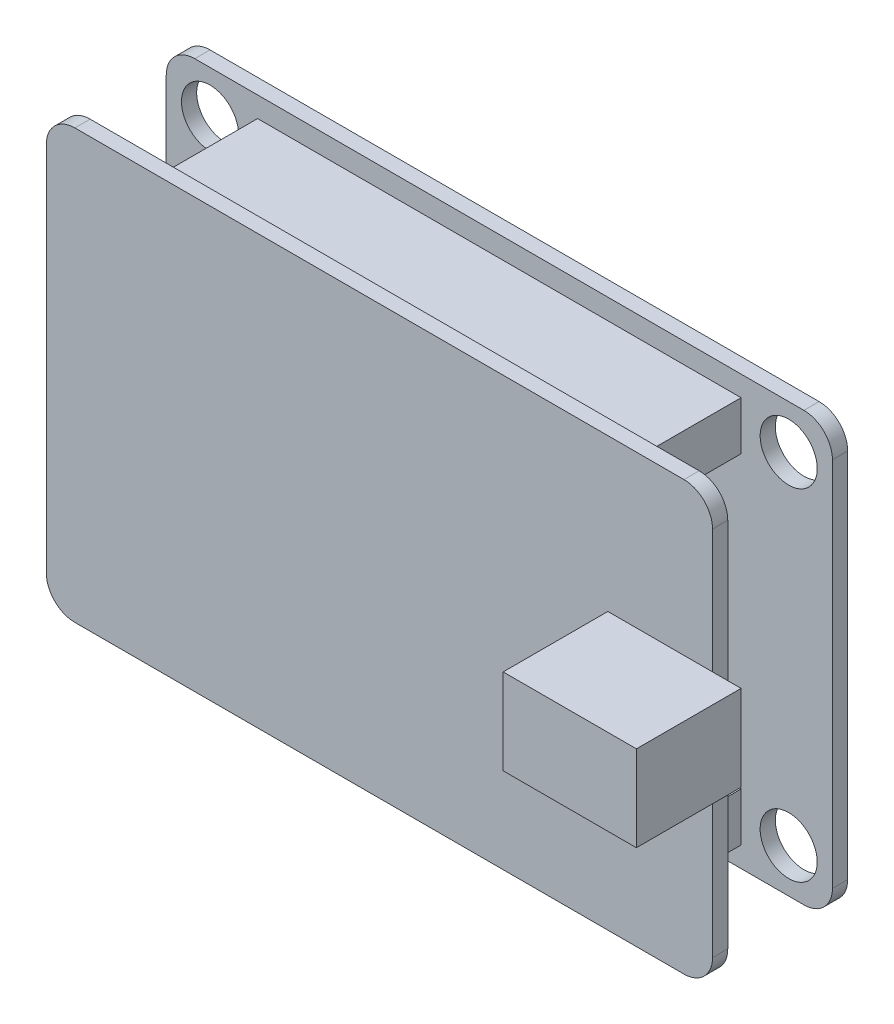
from build123d import *

# Parameters (mm, degrees)
SKETCH_1_R      = 3
EXTRUDE_1_DEPTH = 1.6
SKETCH_2_W      = 50.8
SKETCH_2_H      = 5.1
EXTRUDE_2_DEPTH = 11
EXTRUDE_3_DEPTH = 1.6
SKETCH_4_W      = 14
SKETCH_4_H      = 9
EXTRUDE_4_DEPTH = 11


with BuildPart() as part:
    # 草图1 → 凸台-拉伸1 (new body)
    with BuildSketch(Plane.XY):
        with BuildLine():
            Line((-32, -22.5), (32, -22.5))
            ThreePointArc((32, -22.5), (34.121320344, -21.621320344), (35, -19.5))
            Line((35, -19.5), (35, 19.5))
            ThreePointArc((35, 19.5), (34.121320344, 21.621320344), (32, 22.5))
            Line((32, 22.5), (-32, 22.5))
            ThreePointArc((-32, 22.5), (-34.121320344, 21.621320344), (-35, 19.5))
            Line((-35, 19.5), (-35, -19.5))
            ThreePointArc((-35, -19.5), (-34.121320344, -21.621320344), (-32, -22.5))
        make_face()
        with Locations((-30.4, 17.9)):
            Circle(SKETCH_1_R, mode=Mode.SUBTRACT)
        with Locations((30.4, 17.9)):
            Circle(SKETCH_1_R, mode=Mode.SUBTRACT)
        with Locations((30.4, -17.9)):
            Circle(SKETCH_1_R, mode=Mode.SUBTRACT)
        with Locations((-30.4, -17.9)):
            Circle(SKETCH_1_R, mode=Mode.SUBTRACT)
    extrude(amount=EXTRUDE_1_DEPTH)

    # 草图2 → 凸台-拉伸2 (add)
    with BuildSketch(Plane.XY.offset(1.6)):
        with Locations((0, 17.8)):
            Rectangle(SKETCH_2_W, SKETCH_2_H)
        with Locations((0, -17.8)):
            Rectangle(SKETCH_2_W, SKETCH_2_H)
    extrude(amount=EXTRUDE_2_DEPTH)

    # 草图3 → 凸台-拉伸3 (add)
    with BuildSketch(Plane.XY.offset(12.6)):
        with BuildLine():
            Line((35, -19.5), (35, 19.5))
            ThreePointArc((35, 19.5), (34.121320344, 21.621320344), (32, 22.5))
            Line((32, 22.5), (-32, 22.5))
            ThreePointArc((-32, 22.5), (-34.121320344, 21.621320344), (-35, 19.5))
            Line((-35, 19.5), (-35, -19.5))
            ThreePointArc((-35, -19.5), (-34.121320344, -21.621320344), (-32, -22.5))
            Line((-32, -22.5), (32, -22.5))
            ThreePointArc((32, -22.5), (34.121320344, -21.621320344), (35, -19.5))
        make_face()
    extrude(amount=EXTRUDE_3_DEPTH)

    # 草图4 → 凸台-拉伸4 (add)
    with BuildSketch(Plane.XY.offset(14.2)):
        with Locations((31, 2)):
            Rectangle(SKETCH_4_W, SKETCH_4_H)
    extrude(amount=EXTRUDE_4_DEPTH)


solid = part.part
